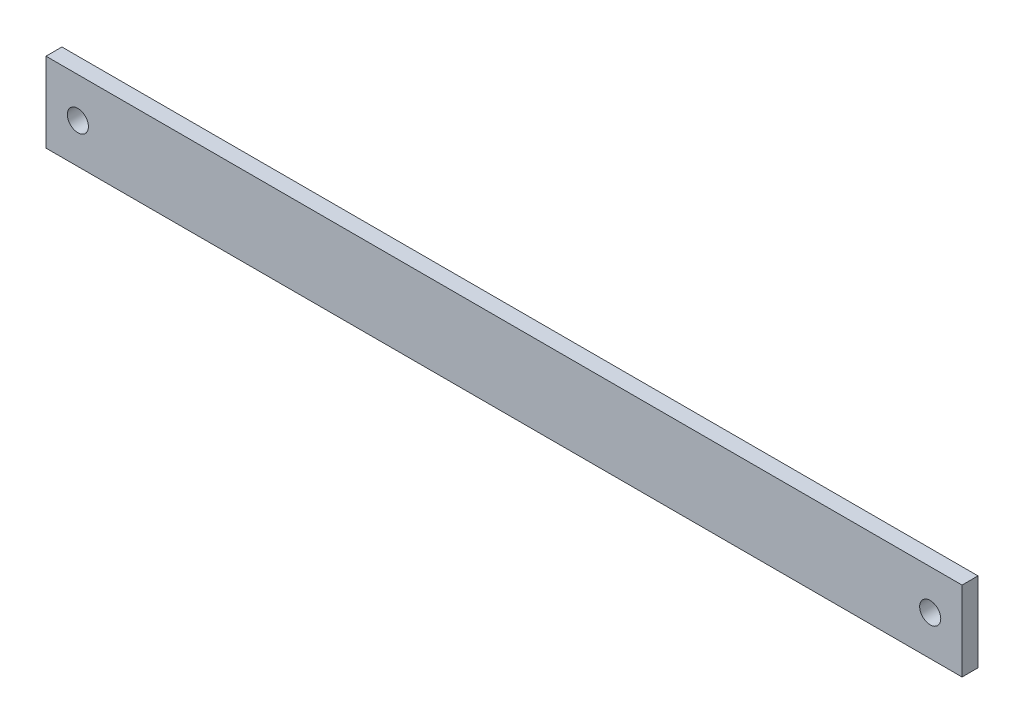
from build123d import *

# Parameters (mm, degrees)
EXTRUSION_BASE_SKETCH_W      = 230
EXTRUSION_BASE_SKETCH_H      = 20
EXTRUSION_BASE_SKETCH_R      = 2.65
EXTRUSION_BASE_EXTRUDE_DEPTH = 4


with BuildPart() as part:
    # Extrusion Base Sketch → Extrusion Base Extrude (new body)
    with BuildSketch(Plane.XY):
        with Locations((93.75, 7.5)):
            Rectangle(EXTRUSION_BASE_SKETCH_W, EXTRUSION_BASE_SKETCH_H)
        with Locations((-13.25, 7.5)):
            Circle(EXTRUSION_BASE_SKETCH_R, mode=Mode.SUBTRACT)
        with Locations((200.75, 7.5)):
            Circle(EXTRUSION_BASE_SKETCH_R, mode=Mode.SUBTRACT)
    extrude(amount=-EXTRUSION_BASE_EXTRUDE_DEPTH)


solid = part.part
